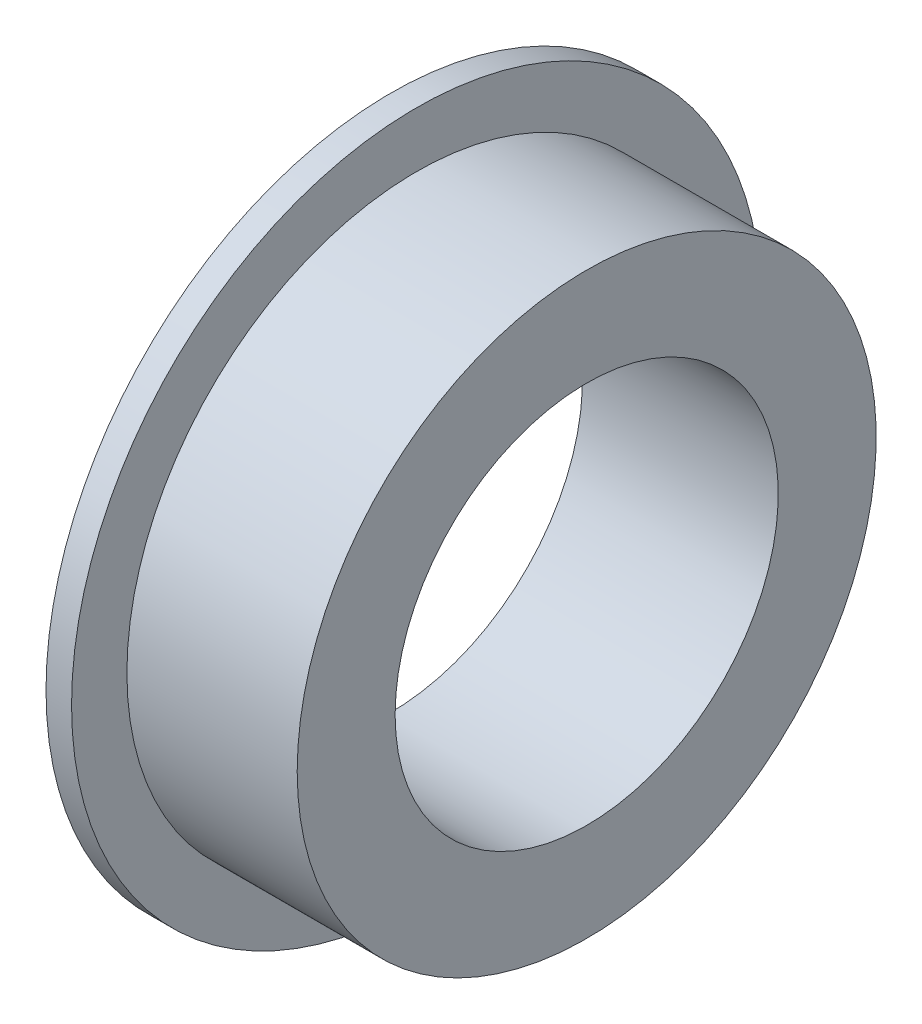
from build123d import *


with BuildPart() as part:
    # Sketch1 → Revolve1 (revolve)
    with BuildSketch(Plane.XY):
        Polygon((0, 4.05), (0.3, 4.05), (0.3, 3.4), (2.3, 3.4), (2.3, 2.25), (0, 2.25), align=None)
    revolve(axis=Axis((0, 0, 0), (1, 0, 0)))


solid = part.part
